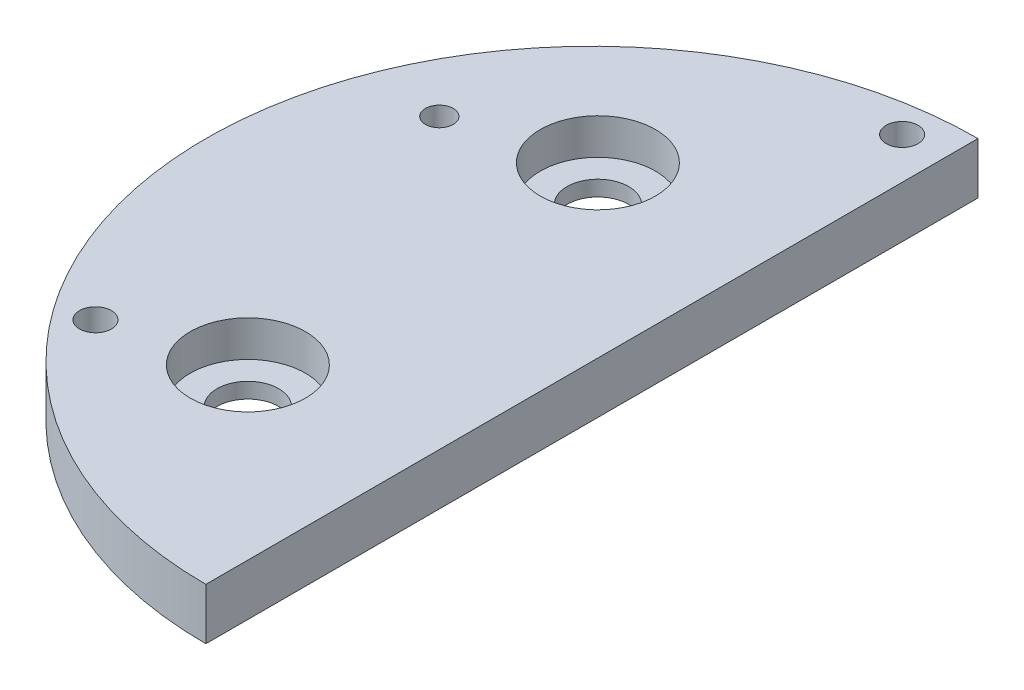
from build123d import *

# Parameters (mm, degrees)
AUFSATZ_LINEAR_AUSTRAGEN1_DEPTH = 5
SKIZZE11_R                      = 5.6
SCHNITT_LINEAR_AUSTRAGEN1_DEPTH = 3.5
SKIZZE12_R                      = 3
SCHNITT_LINEAR_AUSTRAGEN2_DEPTH = 1.5
SKIZZE20_R                      = 1.55
SCHNITT_LINEAR_AUSTRAGEN4_DEPTH = 85.001488082
SKIZZE21_R                      = 1.55
SCHNITT_LINEAR_AUSTRAGEN5_DEPTH = 85.001488082
SKIZZE22_R                      = 1.35
SCHNITT_LINEAR_AUSTRAGEN6_DEPTH = 3.5


with BuildPart() as part:
    # Skizze1 → Aufsatz-Linear austragen1 (new body)
    with BuildSketch(Plane(origin=(0, 0, 0), x_dir=(1, 0, 0), z_dir=(0, 1, 0))):
        with BuildLine():
            Line((0, 0), (0, -75))
            ThreePointArc((0, -75), (-37.5, -37.5), (0, 0))
        make_face()
    extrude(amount=AUFSATZ_LINEAR_AUSTRAGEN1_DEPTH)

    # Skizze11 → Schnitt-Linear austragen1 (cut)
    with BuildSketch(Plane(origin=(0, 5, 0), x_dir=(1, 0, 0), z_dir=(0, 1, 0))):
        with Locations((-16.42, -20.5)):
            Circle(SKIZZE11_R)
        with Locations((-16.42, -54.5)):
            Circle(SKIZZE11_R)
    extrude(amount=-SCHNITT_LINEAR_AUSTRAGEN1_DEPTH, mode=Mode.SUBTRACT)

    # Skizze12 → Schnitt-Linear austragen2 (cut)
    with BuildSketch(Plane(origin=(0, 1.5, 0), x_dir=(1, 0, 0), z_dir=(0, 1, 0))):
        with Locations((-16.42, -54.5)):
            Circle(SKIZZE12_R)
        with Locations((-16.42, -20.5)):
            Circle(SKIZZE12_R)
    extrude(amount=-SCHNITT_LINEAR_AUSTRAGEN2_DEPTH, mode=Mode.SUBTRACT)

    # Skizze20 → Schnitt-Linear austragen4 (cut, through all)
    with BuildSketch(Plane(origin=(0, 5, 0), x_dir=(1, 0, 0), z_dir=(0, 1, 0))):
        with Locations((-4.028895692, -3.344130988)):
            Circle(SKIZZE20_R)
    extrude(amount=-SCHNITT_LINEAR_AUSTRAGEN4_DEPTH, mode=Mode.SUBTRACT)

    # Skizze21 → Schnitt-Linear austragen5 (cut, through all)
    with BuildSketch(Plane(origin=(0, 5, 0), x_dir=(1, 0, 0), z_dir=(0, 1, 0))):
        with Locations((-27.612806043, -58.108531156)):
            Circle(SKIZZE21_R)
    extrude(amount=-SCHNITT_LINEAR_AUSTRAGEN5_DEPTH, mode=Mode.SUBTRACT)

    # Skizze22 → Schnitt-Linear austragen6 (cut)
    with BuildSketch(Plane(origin=(0, 5, 0), x_dir=(1, 0, 0), z_dir=(0, 1, 0))):
        with Locations((-28.019637196, -24.302246817)):
            Circle(SKIZZE22_R)
    extrude(amount=-SCHNITT_LINEAR_AUSTRAGEN6_DEPTH, mode=Mode.SUBTRACT)


solid = part.part
